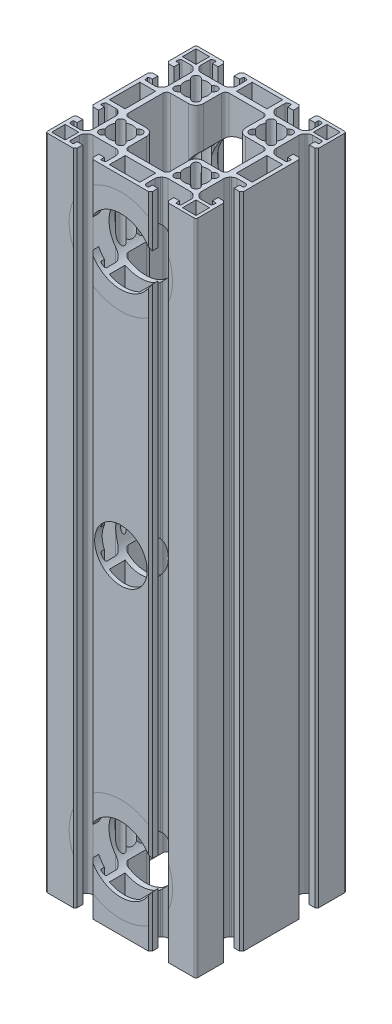
from build123d import *

# Parameters (mm, degrees)
SKETCH1_W           = 8.4
SKETCH1_H           = 16.2
SKETCH1_W_2         = 7.2
SKETCH1_H_2         = 7.2
SKETCH1_W_3         = 16.2
SKETCH1_H_3         = 8.4
BOSS_EXTRUDE1_DEPTH = 350
SKETCH2_R           = 12.5
SKETCH2_R_2         = 17.5
CUT_EXTRUDE1_DEPTH  = 362.26101574
SKETCH5_R           = 14
CUT_EXTRUDE2_DEPTH  = 117


with BuildPart() as part:
    # Sketch1 → Boss-Extrude1 (new body)
    with BuildSketch(Plane(origin=(0, 0, 0), x_dir=(1, 0, 0), z_dir=(0, 1, 0))):
        with BuildLine():
            Line((39.881157874, -42.704615906), (39.881157874, -28.954615906))
            Line((39.881157874, -28.954615906), (38.881157874, -27.954615906))
            Line((38.881157874, -27.954615906), (35.881157874, -27.954615906))
            Line((35.881157874, -27.954615906), (35.881157874, -30.954615906))
            Line((35.881157874, -30.954615906), (37.485281077, -30.954615906))
            ThreePointArc((37.485281077, -30.954615906), (37.868303299, -31.133222101), (37.977684954, -31.541439995))
            Line((37.977684954, -31.541439995), (37.797926779, -32.560899266))
            ThreePointArc((37.797926779, -32.560899266), (37.49010865, -33.094055905), (36.911599801, -33.304615906))
            Line((36.911599801, -33.304615906), (32.215023493, -33.304615906))
            ThreePointArc((32.215023493, -33.304615906), (31.066973196, -33.076254504), (30.09370315, -32.42593625))
            Line((30.09370315, -32.42593625), (29.55983753, -31.89207063))
            ThreePointArc((29.55983753, -31.89207063), (28.909519276, -30.918800583), (28.681157874, -29.770750286))
            Line((28.681157874, -29.770750286), (28.681157874, -17.638481526))
            ThreePointArc((28.681157874, -17.638481526), (28.909519276, -16.490431229), (29.55983753, -15.517161182))
            Line((29.55983753, -15.517161182), (30.09370315, -14.983295562))
            ThreePointArc((30.09370315, -14.983295562), (31.066973196, -14.332977309), (32.215023493, -14.104615906))
            Line((32.215023493, -14.104615906), (36.911599801, -14.104615906))
            ThreePointArc((36.911599801, -14.104615906), (37.49010865, -14.315175907), (37.797926779, -14.848332546))
            Line((37.797926779, -14.848332546), (37.977684954, -15.867791817))
            ThreePointArc((37.977684954, -15.867791817), (37.868303299, -16.276009711), (37.485281077, -16.454615906))
            Line((37.485281077, -16.454615906), (35.881157874, -16.454615906))
            Line((35.881157874, -16.454615906), (35.881157874, -19.454615906))
            Line((35.881157874, -19.454615906), (38.881157874, -19.454615906))
            Line((38.881157874, -19.454615906), (39.881157874, -18.454615906))
            Line((39.881157874, -18.454615906), (39.881157874, 11.045384094))
            Line((39.881157874, 11.045384094), (38.881157874, 12.045384094))
            Line((38.881157874, 12.045384094), (35.881157874, 12.045384094))
            Line((35.881157874, 12.045384094), (35.881157874, 9.045384094))
            Line((35.881157874, 9.045384094), (37.485281077, 9.045384094))
            ThreePointArc((37.485281077, 9.045384094), (37.868303299, 8.866777899), (37.977684954, 8.458560005))
            Line((37.977684954, 8.458560005), (37.797926779, 7.439100734))
            ThreePointArc((37.797926779, 7.439100734), (37.49010865, 6.905944095), (36.911599801, 6.695384094))
            Line((36.911599801, 6.695384094), (32.215023493, 6.695384094))
            ThreePointArc((32.215023493, 6.695384094), (31.066973196, 6.923745496), (30.09370315, 7.57406375))
            Line((30.09370315, 7.57406375), (29.55983753, 8.10792937))
            ThreePointArc((29.55983753, 8.10792937), (28.909519276, 9.081199417), (28.681157874, 10.229249714))
            Line((28.681157874, 10.229249714), (28.681157874, 22.361518474))
            ThreePointArc((28.681157874, 22.361518474), (28.909519276, 23.509568771), (29.55983753, 24.482838818))
            Line((29.55983753, 24.482838818), (30.09370315, 25.016704438))
            ThreePointArc((30.09370315, 25.016704438), (31.066973196, 25.667022691), (32.215023493, 25.895384094))
            Line((32.215023493, 25.895384094), (36.911599801, 25.895384094))
            ThreePointArc((36.911599801, 25.895384094), (37.49010865, 25.684824093), (37.797926779, 25.151667454))
            Line((37.797926779, 25.151667454), (37.977684954, 24.132208183))
            ThreePointArc((37.977684954, 24.132208183), (37.868303299, 23.723990289), (37.485281077, 23.545384094))
            Line((37.485281077, 23.545384094), (35.881157874, 23.545384094))
            Line((35.881157874, 23.545384094), (35.881157874, 20.545384094))
            Line((35.881157874, 20.545384094), (38.881157874, 20.545384094))
            Line((38.881157874, 20.545384094), (39.881157874, 21.545384094))
            Line((39.881157874, 21.545384094), (39.881157874, 35.295384094))
            ThreePointArc((39.881157874, 35.295384094), (39.588264655, 36.002490875), (38.881157874, 36.295384094))
            Line((38.881157874, 36.295384094), (25.131157874, 36.295384094))
            Line((25.131157874, 36.295384094), (24.131157874, 35.295384094))
            Line((24.131157874, 35.295384094), (24.131157874, 32.295384094))
            Line((24.131157874, 32.295384094), (27.131157874, 32.295384094))
            Line((27.131157874, 32.295384094), (27.131157874, 33.899507298))
            ThreePointArc((27.131157874, 33.899507298), (27.309764069, 34.282529519), (27.717981962, 34.391911174))
            Line((27.717981962, 34.391911174), (28.737441233, 34.212152999))
            ThreePointArc((28.737441233, 34.212152999), (29.270597872, 33.90433487), (29.481157874, 33.325826021))
            Line((29.481157874, 33.325826021), (29.481157874, 28.629249714))
            ThreePointArc((29.481157874, 28.629249714), (29.252796471, 27.481199417), (28.602478217, 26.50792937))
            Line((28.602478217, 26.50792937), (28.068612597, 25.97406375))
            ThreePointArc((28.068612597, 25.97406375), (27.095342551, 25.323745496), (25.947292254, 25.095384094))
            Line((25.947292254, 25.095384094), (13.815023493, 25.095384094))
            ThreePointArc((13.815023493, 25.095384094), (12.666973196, 25.323745496), (11.69370315, 25.97406375))
            Line((11.69370315, 25.97406375), (11.15983753, 26.50792937))
            ThreePointArc((11.15983753, 26.50792937), (10.509519276, 27.481199417), (10.281157874, 28.629249714))
            Line((10.281157874, 28.629249714), (10.281157874, 33.325826021))
            ThreePointArc((10.281157874, 33.325826021), (10.491717875, 33.90433487), (11.024874514, 34.212152999))
            Line((11.024874514, 34.212152999), (12.044333785, 34.391911174))
            ThreePointArc((12.044333785, 34.391911174), (12.452551678, 34.282529519), (12.631157874, 33.899507298))
            Line((12.631157874, 33.899507298), (12.631157874, 32.295384094))
            Line((12.631157874, 32.295384094), (15.631157874, 32.295384094))
            Line((15.631157874, 32.295384094), (15.631157874, 35.295384094))
            Line((15.631157874, 35.295384094), (14.631157874, 36.295384094))
            Line((14.631157874, 36.295384094), (-14.868842126, 36.295384094))
            Line((-14.868842126, 36.295384094), (-15.868842126, 35.295384094))
            Line((-15.868842126, 35.295384094), (-15.868842126, 32.295384094))
            Line((-15.868842126, 32.295384094), (-12.868842126, 32.295384094))
            Line((-12.868842126, 32.295384094), (-12.868842126, 33.899507298))
            ThreePointArc((-12.868842126, 33.899507298), (-12.690235931, 34.282529519), (-12.282018038, 34.391911174))
            Line((-12.282018038, 34.391911174), (-11.262558767, 34.212152999))
            ThreePointArc((-11.262558767, 34.212152999), (-10.729402128, 33.90433487), (-10.518842126, 33.325826021))
            Line((-10.518842126, 33.325826021), (-10.518842126, 28.629249714))
            ThreePointArc((-10.518842126, 28.629249714), (-10.747203529, 27.481199417), (-11.397521783, 26.50792937))
            Line((-11.397521783, 26.50792937), (-11.931387403, 25.97406375))
            ThreePointArc((-11.931387403, 25.97406375), (-12.904657449, 25.323745496), (-14.052707746, 25.095384094))
            Line((-14.052707746, 25.095384094), (-26.184976507, 25.095384094))
            ThreePointArc((-26.184976507, 25.095384094), (-27.333026804, 25.323745496), (-28.30629685, 25.97406375))
            Line((-28.30629685, 25.97406375), (-28.84016247, 26.50792937))
            ThreePointArc((-28.84016247, 26.50792937), (-29.490480724, 27.481199417), (-29.718842126, 28.629249714))
            Line((-29.718842126, 28.629249714), (-29.718842126, 33.325826021))
            ThreePointArc((-29.718842126, 33.325826021), (-29.508282125, 33.90433487), (-28.975125486, 34.212152999))
            Line((-28.975125486, 34.212152999), (-27.955666215, 34.391911174))
            ThreePointArc((-27.955666215, 34.391911174), (-27.547448322, 34.282529519), (-27.368842126, 33.899507298))
            Line((-27.368842126, 33.899507298), (-27.368842126, 32.295384094))
            Line((-27.368842126, 32.295384094), (-24.368842126, 32.295384094))
            Line((-24.368842126, 32.295384094), (-24.368842126, 35.295384094))
            Line((-24.368842126, 35.295384094), (-25.368842126, 36.295384094))
            Line((-25.368842126, 36.295384094), (-39.118842126, 36.295384094))
            ThreePointArc((-39.118842126, 36.295384094), (-39.825948908, 36.002490875), (-40.118842126, 35.295384094))
            Line((-40.118842126, 35.295384094), (-40.118842126, 21.545384094))
            Line((-40.118842126, 21.545384094), (-39.118842126, 20.545384094))
            Line((-39.118842126, 20.545384094), (-36.118842126, 20.545384094))
            Line((-36.118842126, 20.545384094), (-36.118842126, 23.545384094))
            Line((-36.118842126, 23.545384094), (-37.72296533, 23.545384094))
            ThreePointArc((-37.72296533, 23.545384094), (-38.105987552, 23.723990289), (-38.215369207, 24.132208183))
            Line((-38.215369207, 24.132208183), (-38.035611031, 25.151667454))
            ThreePointArc((-38.035611031, 25.151667454), (-37.727792902, 25.684824093), (-37.149284054, 25.895384094))
            Line((-37.149284054, 25.895384094), (-32.452707746, 25.895384094))
            ThreePointArc((-32.452707746, 25.895384094), (-31.304657449, 25.667022691), (-30.331387403, 25.016704438))
            Line((-30.331387403, 25.016704438), (-29.797521783, 24.482838818))
            ThreePointArc((-29.797521783, 24.482838818), (-29.147203529, 23.509568771), (-28.918842126, 22.361518474))
            Line((-28.918842126, 22.361518474), (-28.918842126, 10.229249714))
            ThreePointArc((-28.918842126, 10.229249714), (-29.147203529, 9.081199417), (-29.797521783, 8.10792937))
            Line((-29.797521783, 8.10792937), (-30.331387403, 7.57406375))
            ThreePointArc((-30.331387403, 7.57406375), (-31.304657449, 6.923745496), (-32.452707746, 6.695384094))
            Line((-32.452707746, 6.695384094), (-37.149284054, 6.695384094))
            ThreePointArc((-37.149284054, 6.695384094), (-37.727792902, 6.905944095), (-38.035611031, 7.439100734))
            Line((-38.035611031, 7.439100734), (-38.215369207, 8.458560005))
            ThreePointArc((-38.215369207, 8.458560005), (-38.105987552, 8.866777899), (-37.72296533, 9.045384094))
            Line((-37.72296533, 9.045384094), (-36.118842126, 9.045384094))
            Line((-36.118842126, 9.045384094), (-36.118842126, 12.045384094))
            Line((-36.118842126, 12.045384094), (-39.118842126, 12.045384094))
            Line((-39.118842126, 12.045384094), (-40.118842126, 11.045384094))
            Line((-40.118842126, 11.045384094), (-40.118842126, -18.454615906))
            Line((-40.118842126, -18.454615906), (-39.118842126, -19.454615906))
            Line((-39.118842126, -19.454615906), (-36.118842126, -19.454615906))
            Line((-36.118842126, -19.454615906), (-36.118842126, -16.454615906))
            Line((-36.118842126, -16.454615906), (-37.72296533, -16.454615906))
            ThreePointArc((-37.72296533, -16.454615906), (-38.105987552, -16.276009711), (-38.215369207, -15.867791817))
            Line((-38.215369207, -15.867791817), (-38.035611031, -14.848332546))
            ThreePointArc((-38.035611031, -14.848332546), (-37.727792902, -14.315175907), (-37.149284054, -14.104615906))
            Line((-37.149284054, -14.104615906), (-32.452707746, -14.104615906))
            ThreePointArc((-32.452707746, -14.104615906), (-31.304657449, -14.332977309), (-30.331387403, -14.983295562))
            Line((-30.331387403, -14.983295562), (-29.797521783, -15.517161182))
            ThreePointArc((-29.797521783, -15.517161182), (-29.147203529, -16.490431229), (-28.918842126, -17.638481526))
            Line((-28.918842126, -17.638481526), (-28.918842126, -29.770750286))
            ThreePointArc((-28.918842126, -29.770750286), (-29.147203529, -30.918800583), (-29.797521783, -31.89207063))
            Line((-29.797521783, -31.89207063), (-30.331387403, -32.42593625))
            ThreePointArc((-30.331387403, -32.42593625), (-31.304657449, -33.076254504), (-32.452707746, -33.304615906))
            Line((-32.452707746, -33.304615906), (-37.149284054, -33.304615906))
            ThreePointArc((-37.149284054, -33.304615906), (-37.727792902, -33.094055905), (-38.035611031, -32.560899266))
            Line((-38.035611031, -32.560899266), (-38.215369207, -31.541439995))
            ThreePointArc((-38.215369207, -31.541439995), (-38.105987552, -31.133222101), (-37.72296533, -30.954615906))
            Line((-37.72296533, -30.954615906), (-36.118842126, -30.954615906))
            Line((-36.118842126, -30.954615906), (-36.118842126, -27.954615906))
            Line((-36.118842126, -27.954615906), (-39.118842126, -27.954615906))
            Line((-39.118842126, -27.954615906), (-40.118842126, -28.954615906))
            Line((-40.118842126, -28.954615906), (-40.118842126, -42.704615906))
            ThreePointArc((-40.118842126, -42.704615906), (-39.825948908, -43.411722687), (-39.118842126, -43.704615906))
            Line((-39.118842126, -43.704615906), (-25.368842126, -43.704615906))
            Line((-25.368842126, -43.704615906), (-24.368842126, -42.704615906))
            Line((-24.368842126, -42.704615906), (-24.368842126, -39.704615906))
            Line((-24.368842126, -39.704615906), (-27.368842126, -39.704615906))
            Line((-27.368842126, -39.704615906), (-27.368842126, -41.30873911))
            ThreePointArc((-27.368842126, -41.30873911), (-27.547448322, -41.691761331), (-27.955666215, -41.801142986))
            Line((-27.955666215, -41.801142986), (-28.975125486, -41.621384811))
            ThreePointArc((-28.975125486, -41.621384811), (-29.508282125, -41.313566682), (-29.718842126, -40.735057833))
            Line((-29.718842126, -40.735057833), (-29.718842126, -36.038481526))
            ThreePointArc((-29.718842126, -36.038481526), (-29.490480724, -34.890431229), (-28.84016247, -33.917161182))
            Line((-28.84016247, -33.917161182), (-28.30629685, -33.383295562))
            ThreePointArc((-28.30629685, -33.383295562), (-27.333026804, -32.732977309), (-26.184976507, -32.504615906))
            Line((-26.184976507, -32.504615906), (-14.052707746, -32.504615906))
            ThreePointArc((-14.052707746, -32.504615906), (-12.904657449, -32.732977309), (-11.931387403, -33.383295562))
            Line((-11.931387403, -33.383295562), (-11.397521783, -33.917161182))
            ThreePointArc((-11.397521783, -33.917161182), (-10.747203529, -34.890431229), (-10.518842126, -36.038481526))
            Line((-10.518842126, -36.038481526), (-10.518842126, -40.735057833))
            ThreePointArc((-10.518842126, -40.735057833), (-10.729402128, -41.313566682), (-11.262558767, -41.621384811))
            Line((-11.262558767, -41.621384811), (-12.282018038, -41.801142986))
            ThreePointArc((-12.282018038, -41.801142986), (-12.690235931, -41.691761331), (-12.868842126, -41.30873911))
            Line((-12.868842126, -41.30873911), (-12.868842126, -39.704615906))
            Line((-12.868842126, -39.704615906), (-15.868842126, -39.704615906))
            Line((-15.868842126, -39.704615906), (-15.868842126, -42.704615906))
            Line((-15.868842126, -42.704615906), (-14.868842126, -43.704615906))
            Line((-14.868842126, -43.704615906), (14.631157874, -43.704615906))
            Line((14.631157874, -43.704615906), (15.631157874, -42.704615906))
            Line((15.631157874, -42.704615906), (15.631157874, -39.704615906))
            Line((15.631157874, -39.704615906), (12.631157874, -39.704615906))
            Line((12.631157874, -39.704615906), (12.631157874, -41.30873911))
            ThreePointArc((12.631157874, -41.30873911), (12.452551678, -41.691761331), (12.044333785, -41.801142986))
            Line((12.044333785, -41.801142986), (11.024874514, -41.621384811))
            ThreePointArc((11.024874514, -41.621384811), (10.491717875, -41.313566682), (10.281157874, -40.735057833))
            Line((10.281157874, -40.735057833), (10.281157874, -36.038481526))
            ThreePointArc((10.281157874, -36.038481526), (10.509519276, -34.890431229), (11.15983753, -33.917161182))
            Line((11.15983753, -33.917161182), (11.69370315, -33.383295562))
            ThreePointArc((11.69370315, -33.383295562), (12.666973196, -32.732977309), (13.815023493, -32.504615906))
            Line((13.815023493, -32.504615906), (25.947292254, -32.504615906))
            ThreePointArc((25.947292254, -32.504615906), (27.095342551, -32.732977309), (28.068612597, -33.383295562))
            Line((28.068612597, -33.383295562), (28.602478217, -33.917161182))
            ThreePointArc((28.602478217, -33.917161182), (29.252796471, -34.890431229), (29.481157874, -36.038481526))
            Line((29.481157874, -36.038481526), (29.481157874, -40.735057833))
            ThreePointArc((29.481157874, -40.735057833), (29.270597872, -41.313566682), (28.737441233, -41.621384811))
            Line((28.737441233, -41.621384811), (27.717981962, -41.801142986))
            ThreePointArc((27.717981962, -41.801142986), (27.309764069, -41.691761331), (27.131157874, -41.30873911))
            Line((27.131157874, -41.30873911), (27.131157874, -39.704615906))
            Line((27.131157874, -39.704615906), (24.131157874, -39.704615906))
            Line((24.131157874, -39.704615906), (24.131157874, -42.704615906))
            Line((24.131157874, -42.704615906), (25.131157874, -43.704615906))
            Line((25.131157874, -43.704615906), (38.881157874, -43.704615906))
            ThreePointArc((38.881157874, -43.704615906), (39.588264655, -43.411722687), (39.881157874, -42.704615906))
        make_face()
        with BuildLine():
            Line((16.522400663, 10.108199759), (17.10833788, 10.694136975))
            ThreePointArc((17.10833788, 10.694136975), (19.881157874, 10.045384094), (22.653977867, 10.694136975))
            Line((22.653977867, 10.694136975), (23.239915084, 10.108199759))
            ThreePointArc((23.239915084, 10.108199759), (26.068342209, 10.108199759), (26.068342209, 12.936626883))
            Line((26.068342209, 12.936626883), (25.482404992, 13.5225641))
            ThreePointArc((25.482404992, 13.5225641), (26.131157874, 16.295384094), (25.482404992, 19.068204088))
            Line((25.482404992, 19.068204088), (26.068342209, 19.654141305))
            ThreePointArc((26.068342209, 19.654141305), (26.068342209, 22.482568429), (23.239915084, 22.482568429))
            Line((23.239915084, 22.482568429), (22.653977867, 21.896631212))
            ThreePointArc((22.653977867, 21.896631212), (19.881157874, 22.545384094), (17.10833788, 21.896631212))
            Line((17.10833788, 21.896631212), (16.522400663, 22.482568429))
            ThreePointArc((16.522400663, 22.482568429), (13.693973538, 22.482568429), (13.693973538, 19.654141305))
            Line((13.693973538, 19.654141305), (14.279910755, 19.068204088))
            ThreePointArc((14.279910755, 19.068204088), (13.631157874, 16.295384094), (14.279910755, 13.5225641))
            Line((14.279910755, 13.5225641), (13.693973538, 12.936626883))
            ThreePointArc((13.693973538, 12.936626883), (13.693973538, 10.108199759), (16.522400663, 10.108199759))
        make_face(mode=Mode.SUBTRACT)
        with Locations((-33.918842126, -3.704615906)):
            Rectangle(SKETCH1_W, SKETCH1_H, mode=Mode.SUBTRACT)
        with BuildLine():
            Line((-23.477599337, 10.108199759), (-22.89166212, 10.694136975))
            ThreePointArc((-22.89166212, 10.694136975), (-20.118842126, 10.045384094), (-17.346022133, 10.694136975))
            Line((-17.346022133, 10.694136975), (-16.760084916, 10.108199759))
            ThreePointArc((-16.760084916, 10.108199759), (-13.931657791, 10.108199759), (-13.931657791, 12.936626883))
            Line((-13.931657791, 12.936626883), (-14.517595008, 13.5225641))
            ThreePointArc((-14.517595008, 13.5225641), (-13.868842126, 16.295384094), (-14.517595008, 19.068204088))
            Line((-14.517595008, 19.068204088), (-13.931657791, 19.654141305))
            ThreePointArc((-13.931657791, 19.654141305), (-13.931657791, 22.482568429), (-16.760084916, 22.482568429))
            Line((-16.760084916, 22.482568429), (-17.346022133, 21.896631212))
            ThreePointArc((-17.346022133, 21.896631212), (-20.118842126, 22.545384094), (-22.89166212, 21.896631212))
            Line((-22.89166212, 21.896631212), (-23.477599337, 22.482568429))
            ThreePointArc((-23.477599337, 22.482568429), (-26.306026462, 22.482568429), (-26.306026462, 19.654141305))
            Line((-26.306026462, 19.654141305), (-25.720089245, 19.068204088))
            ThreePointArc((-25.720089245, 19.068204088), (-26.368842126, 16.295384094), (-25.720089245, 13.5225641))
            Line((-25.720089245, 13.5225641), (-26.306026462, 12.936626883))
            ThreePointArc((-26.306026462, 12.936626883), (-26.306026462, 10.108199759), (-23.477599337, 10.108199759))
        make_face(mode=Mode.SUBTRACT)
        with BuildLine():
            Line((23.239915084, -17.517431571), (22.653977867, -18.103368788))
            ThreePointArc((22.653977867, -18.103368788), (19.881157874, -17.454615906), (17.10833788, -18.103368788))
            Line((17.10833788, -18.103368788), (16.522400663, -17.517431571))
            ThreePointArc((16.522400663, -17.517431571), (13.693973538, -17.517431571), (13.693973538, -20.345858695))
            Line((13.693973538, -20.345858695), (14.279910755, -20.931795912))
            ThreePointArc((14.279910755, -20.931795912), (13.631157874, -23.704615906), (14.279910755, -26.4774359))
            Line((14.279910755, -26.4774359), (13.693973538, -27.063373117))
            ThreePointArc((13.693973538, -27.063373117), (13.693973538, -29.891800241), (16.522400663, -29.891800241))
            Line((16.522400663, -29.891800241), (17.10833788, -29.305863025))
            ThreePointArc((17.10833788, -29.305863025), (19.881157874, -29.954615906), (22.653977867, -29.305863025))
            Line((22.653977867, -29.305863025), (23.239915084, -29.891800241))
            ThreePointArc((23.239915084, -29.891800241), (26.068342209, -29.891800241), (26.068342209, -27.063373117))
            Line((26.068342209, -27.063373117), (25.482404992, -26.4774359))
            ThreePointArc((25.482404992, -26.4774359), (26.131157874, -23.704615906), (25.482404992, -20.931795912))
            Line((25.482404992, -20.931795912), (26.068342209, -20.345858695))
            ThreePointArc((26.068342209, -20.345858695), (26.068342209, -17.517431571), (23.239915084, -17.517431571))
        make_face(mode=Mode.SUBTRACT)
        with Locations((-34.918842126, -38.504615906)):
            Rectangle(SKETCH1_W_2, SKETCH1_H_2, mode=Mode.SUBTRACT)
        with BuildLine():
            Line((-16.760084916, -17.517431571), (-17.346022133, -18.103368788))
            ThreePointArc((-17.346022133, -18.103368788), (-20.118842126, -17.454615906), (-22.89166212, -18.103368788))
            Line((-22.89166212, -18.103368788), (-23.477599337, -17.517431571))
            ThreePointArc((-23.477599337, -17.517431571), (-26.306026462, -17.517431571), (-26.306026462, -20.345858695))
            Line((-26.306026462, -20.345858695), (-25.720089245, -20.931795912))
            ThreePointArc((-25.720089245, -20.931795912), (-26.368842126, -23.704615906), (-25.720089245, -26.4774359))
            Line((-25.720089245, -26.4774359), (-26.306026462, -27.063373117))
            ThreePointArc((-26.306026462, -27.063373117), (-26.306026462, -29.891800241), (-23.477599337, -29.891800241))
            Line((-23.477599337, -29.891800241), (-22.89166212, -29.305863025))
            ThreePointArc((-22.89166212, -29.305863025), (-20.118842126, -29.954615906), (-17.346022133, -29.305863025))
            Line((-17.346022133, -29.305863025), (-16.760084916, -29.891800241))
            ThreePointArc((-16.760084916, -29.891800241), (-13.931657791, -29.891800241), (-13.931657791, -27.063373117))
            Line((-13.931657791, -27.063373117), (-14.517595008, -26.4774359))
            ThreePointArc((-14.517595008, -26.4774359), (-13.868842126, -23.704615906), (-14.517595008, -20.931795912))
            Line((-14.517595008, -20.931795912), (-13.931657791, -20.345858695))
            ThreePointArc((-13.931657791, -20.345858695), (-13.931657791, -17.517431571), (-16.760084916, -17.517431571))
        make_face(mode=Mode.SUBTRACT)
        with Locations((-34.918842126, 31.095384094)):
            Rectangle(SKETCH1_W_2, SKETCH1_H_2, mode=Mode.SUBTRACT)
        with Locations((34.681157874, -38.504615906)):
            Rectangle(SKETCH1_W_2, SKETCH1_H_2, mode=Mode.SUBTRACT)
        with Locations((34.681157874, 31.095384094)):
            Rectangle(SKETCH1_W_2, SKETCH1_H_2, mode=Mode.SUBTRACT)
        with Locations((-0.118842126, 30.095384094)):
            Rectangle(SKETCH1_W_3, SKETCH1_H_3, mode=Mode.SUBTRACT)
        with BuildLine():
            Line((11.081157874, -28.504615906), (11.081157874, -18.904615906))
            ThreePointArc((11.081157874, -18.904615906), (12.252730749, -16.076188781), (15.081157874, -14.904615906))
            Line((15.081157874, -14.904615906), (24.681157874, -14.904615906))
            ThreePointArc((24.681157874, -14.904615906), (26.095371436, -14.318829468), (26.681157874, -12.904615906))
            Line((26.681157874, -12.904615906), (26.681157874, 5.495384094))
            ThreePointArc((26.681157874, 5.495384094), (26.095371436, 6.909597656), (24.681157874, 7.495384094))
            Line((24.681157874, 7.495384094), (15.081157874, 7.495384094))
            ThreePointArc((15.081157874, 7.495384094), (12.252730749, 8.666956969), (11.081157874, 11.495384094))
            Line((11.081157874, 11.495384094), (11.081157874, 21.095384094))
            ThreePointArc((11.081157874, 21.095384094), (10.495371436, 22.509597656), (9.081157874, 23.095384094))
            Line((9.081157874, 23.095384094), (-9.318842126, 23.095384094))
            ThreePointArc((-9.318842126, 23.095384094), (-10.733055689, 22.509597656), (-11.318842126, 21.095384094))
            Line((-11.318842126, 21.095384094), (-11.318842126, 11.495384094))
            ThreePointArc((-11.318842126, 11.495384094), (-12.490415002, 8.666956969), (-15.318842126, 7.495384094))
            Line((-15.318842126, 7.495384094), (-24.918842126, 7.495384094))
            ThreePointArc((-24.918842126, 7.495384094), (-26.333055689, 6.909597656), (-26.918842126, 5.495384094))
            Line((-26.918842126, 5.495384094), (-26.918842126, -12.904615906))
            ThreePointArc((-26.918842126, -12.904615906), (-26.333055689, -14.318829468), (-24.918842126, -14.904615906))
            Line((-24.918842126, -14.904615906), (-15.318842126, -14.904615906))
            ThreePointArc((-15.318842126, -14.904615906), (-12.490415002, -16.076188781), (-11.318842126, -18.904615906))
            Line((-11.318842126, -18.904615906), (-11.318842126, -28.504615906))
            ThreePointArc((-11.318842126, -28.504615906), (-10.733055689, -29.918829468), (-9.318842126, -30.504615906))
            Line((-9.318842126, -30.504615906), (9.081157874, -30.504615906))
            ThreePointArc((9.081157874, -30.504615906), (10.495371436, -29.918829468), (11.081157874, -28.504615906))
        make_face(mode=Mode.SUBTRACT)
        with Locations((-0.118842126, -37.504615906)):
            Rectangle(SKETCH1_W_3, SKETCH1_H_3, mode=Mode.SUBTRACT)
        with Locations((33.681157874, -3.704615906)):
            Rectangle(SKETCH1_W, SKETCH1_H, mode=Mode.SUBTRACT)
    extrude(amount=BOSS_EXTRUDE1_DEPTH)

    # Sketch2 → Cut-Extrude1 (cut, through all)
    with BuildSketch(Plane.XY.offset(43.704615906)):
        with Locations((-0.059421063, 175)):
            Circle(SKETCH2_R)
        with Locations(Location((-0.106957914, 315, 0), (0, 0, 25.931054068))):
            Circle(SKETCH2_R_2)
        with Locations(Location((-0.106957914, 35, 0), (0, 0, 334.068945932))):
            Circle(SKETCH2_R_2)
    extrude(amount=-CUT_EXTRUDE1_DEPTH, mode=Mode.SUBTRACT)

    # Sketch5 → Cut-Extrude2 (cut)
    with BuildSketch(Plane(origin=(0, 0, -36.295384094), x_dir=(-1, 0, 0), z_dir=(0, 0, -1))):
        with Locations((0.059421063, 175)):
            Circle(SKETCH5_R)
    extrude(amount=-CUT_EXTRUDE2_DEPTH, mode=Mode.SUBTRACT)


solid = part.part
